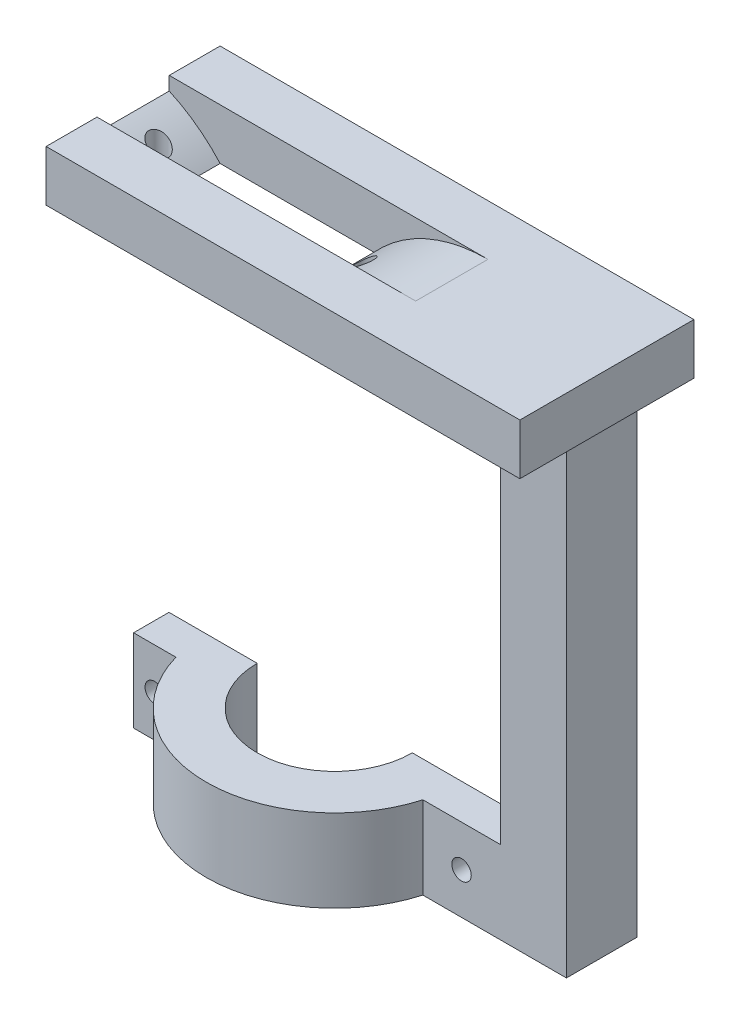
from build123d import *

# Parameters (mm, degrees)
SKETCH_1_W                = 50.28
SKETCH_1_H                = 34.2
SKETCH_1_W_2              = 30.28
SKETCH_1_H_2              = 14.2
EXTRUDE_1_DEPTH           = 12.25
SKETCH_4_W                = 13
SKETCH_4_H                = 13.91
EXTRUDE_1_2_DEPTH         = 74.82
SKETCH_5_W                = 13.91
SKETCH_5_H                = 16.23
EXTRUDE_2_DEPTH           = 16
SKETCH_7_R                = 25.25
SKETCH_7_R_2              = 15.25
EXTRUDE_2_2_DEPTH         = 16.23
SKETCH_15_R               = 1.91
CUT_EXTRUDE_6_DEPTH       = 97.964478439
SKETCH_18_W               = 49.344544624
SKETCH_18_H               = 6.125
CUT_EXTRUDE_8_DEPTH       = 101.789238284
SKETCH_19_W               = 34.2
SKETCH_19_H               = 6.125
CUT_EXTRUDE_9_DEPTH       = 10
SKETCH_21_R               = 1.91
CUT_EXTRUDE_10_DEPTH      = 10
SKETCH_20_R               = 1.91
CUT_EXTRUDE_11_DEPTH      = 10
FILLET_START              = -7.1
FILLET_1_DEPTH            = 14.2
FILLET_2_DEPTH            = 14.2
SKETCH_29_W               = 13.91
SKETCH_29_H               = 74.82
EXTRUDE_5_DEPTH           = 10
SKETCH_30_W               = 10
SKETCH_30_H               = 58.59
CUT_EXTRUDE_13_DEPTH      = 97.964478439
SKETCH_32_W               = 34.2
SKETCH_32_H               = 5.745736365
EXTRUDE_6_DEPTH           = 10
CUT_EXTRUDE_16_DEPTH      = 50
CUT_EXTRUDE_16_DEPTH_BACK = 50
SKETCH_38_W               = 116.985630298
SKETCH_38_H               = 80.538350638
SKETCH_41_W               = 13.91
SKETCH_41_H               = 5.745736365
EXTRUDE_7_DEPTH           = 3
SKETCH_42_W               = 13
SKETCH_42_H               = 13.91
EXTRUDE_8_DEPTH           = 74.82
SKETCH_43_W               = 13.91
SKETCH_43_H               = 16.23
EXTRUDE_9_DEPTH           = 15.22
SKETCH_44_R               = 1.91
CUT_EXTRUDE_17_DEPTH      = 15.22
SKETCH_46_R               = 25.25
SKETCH_46_R_2             = 15.25
EXTRUDE_6_2_DEPTH         = 16.23
EXTRUDE_10_DEPTH          = 7.22
EXTRUDE_10_DEPTH_BACK     = 10
SKETCH_47_W               = 13.91
SKETCH_47_H               = 16.23
SKETCH_50_W               = 3.056753925
SKETCH_50_H               = 16.23
CUT_EXTRUDE_18_DEPTH      = 96.578211037
SKETCH_51_R               = 1.91
CUT_EXTRUDE_19_DEPTH      = 95.015226304
SKETCH_52_W               = 92.841945613
SKETCH_52_H               = 30
CUT_EXTRUDE_20_DEPTH      = 84.840694713
CUT_EXTRUDE_22_DEPTH      = 50
CUT_EXTRUDE_22_DEPTH_BACK = 50
SKETCH_53_W               = 63.541345486
SKETCH_53_H               = 14.170740414
SKETCH_54_W               = 10
SKETCH_54_H               = 10.145
CUT_EXTRUDE_23_DEPTH      = 50
SKETCH_55_W               = 13
SKETCH_55_H               = 13.91
EXTRUDE_11_DEPTH          = 10
SKETCH_57_W               = 15
SKETCH_57_H               = 34.2
EXTRUDE_12_DEPTH          = 10
SKETCH_58_W               = 34.2
SKETCH_58_H               = 10
EXTRUDE_13_DEPTH          = 27.85
SKETCH_60_W               = 34.2
SKETCH_60_H               = 10
EXTRUDE_14_DEPTH          = 50.28
SKETCH_62_W               = 30.28
SKETCH_62_H               = 14.2
CUT_EXTRUDE_24_DEPTH      = 50.28
SKETCH_64_R               = 1.91
CUT_EXTRUDE_25_DEPTH      = 10
FILLET_3_R                = 30


with BuildPart() as part:
    # 草圖1 → Extrude 1 (new body)
    with BuildSketch(Plane(origin=(0, 0, 0), x_dir=(1, 0, 0), z_dir=(0, 1, 0))):
        Rectangle(SKETCH_1_W, SKETCH_1_H)
        Rectangle(SKETCH_1_W_2, SKETCH_1_H_2, mode=Mode.SUBTRACT)
    extrude(amount=EXTRUDE_1_DEPTH)

    # 草圖4 → Extrude 1 2 (add)
    with BuildSketch(Plane.XZ):
        with Locations((18.64, 0)):
            Rectangle(SKETCH_4_W, SKETCH_4_H)
    extrude(amount=EXTRUDE_1_2_DEPTH)

    # 草圖5 → Extrude 2 (add)
    with BuildSketch(Plane.ZY.offset(-12.14)):
        with Locations((0, -66.705)):
            Rectangle(SKETCH_5_W, SKETCH_5_H)
    extrude(amount=EXTRUDE_2_DEPTH)

    # 草圖7 → Extrude 2 2 (add)
    with BuildSketch(Plane(origin=(3.626674765, -74.82, 0), x_dir=(1, 0, 0), z_dir=(0, -1, 0))):
        with Locations((-30.978154344, 0)):
            Circle(SKETCH_7_R)
        with Locations((-30.978154344, 0)):
            Circle(SKETCH_7_R_2, mode=Mode.SUBTRACT)
    extrude(amount=-EXTRUDE_2_2_DEPTH)

    # 草圖15 → 除料-伸長6 (cut, through all)
    with BuildSketch(Plane(origin=(0, 0, -6.955), x_dir=(-1, 0, 0), z_dir=(0, 0, -1))):
        with Locations((-4.530883248, -66.705)):
            Circle(SKETCH_15_R)
    extrude(amount=-CUT_EXTRUDE_6_DEPTH, mode=Mode.SUBTRACT)

    # 草圖18 → 除料-伸長8 (cut, through all)
    with BuildSketch(Plane(origin=(0, 0, -17.1), x_dir=(-1, 0, 0), z_dir=(0, 0, -1))):
        with Locations((0.467727688, 9.1875)):
            Rectangle(SKETCH_18_W, SKETCH_18_H)
    extrude(amount=-CUT_EXTRUDE_8_DEPTH, mode=Mode.SUBTRACT)

    # 草圖19 → 除料-伸長9 (cut)
    with BuildSketch(Plane.ZY.offset(-24.204544624)):
        with Locations((0, 9.1875)):
            Rectangle(SKETCH_19_W, SKETCH_19_H)
    extrude(amount=-CUT_EXTRUDE_9_DEPTH, mode=Mode.SUBTRACT)

    # 草圖21 → 除料-伸長10 (cut)
    with BuildSketch(Plane(origin=(0, 6.125, 0), x_dir=(1, 0, 0), z_dir=(0, 1, 0))):
        with Locations(Location((17.69, 0, 0), (0, 0, 270))):
            Circle(SKETCH_21_R)
    extrude(amount=-CUT_EXTRUDE_10_DEPTH, mode=Mode.SUBTRACT)

    # 草圖20 → 除料-伸長11 (cut)
    with BuildSketch(Plane(origin=(0, 6.125, 0), x_dir=(1, 0, 0), z_dir=(0, 1, 0))):
        with Locations(Location((-17.395, 0, 0), (0, 0, 270))):
            Circle(SKETCH_20_R)
    extrude(amount=-CUT_EXTRUDE_11_DEPTH, mode=Mode.SUBTRACT)

    # 圓角1: read off the stored shape, not the designer's step
    # 圓角1 outline → 圓角1 (cut)
    with BuildSketch(Plane.XY.offset(FILLET_START)):
        with BuildLine():
            add(Edge.make_bspline(
                [(-15.14, 0), (-21.974170252, 5.199829476), (-25.14, 5.745736365)],
                knots=[0, 0, 0, 0.664102345, 0.664102345, 0.664102345], degree=2, weights=[1, 2.223777218, 1.822127795]))
            Line((-15.14, 0), (-15.14, 6.125))
            Line((-15.14, 6.125), (-25.14, 6.125))
            Line((-25.14, 6.125), (-25.14, 5.745736365))
        make_face()
    extrude(amount=FILLET_1_DEPTH, mode=Mode.SUBTRACT)

    # 圓角2: read off the stored shape, not the designer's step
    # 圓角2 outline → 圓角2 (cut)
    with BuildSketch(Plane.XY.offset(FILLET_START)):
        with BuildLine():
            Line((15.14, 6.125), (15.14, 0))
            add(Edge.make_bspline(
                [(15.14, 0), (21.974170252, 5.199829476), (25.14, 5.745736365)],
                knots=[0, 0, 0, 0.664102345, 0.664102345, 0.664102345], degree=2, weights=[1, 2.223777218, 1.822127795]))
            Line((25.14, 5.745736365), (25.14, 6.125))
            Line((25.14, 6.125), (15.14, 6.125))
        make_face()
    extrude(amount=FILLET_2_DEPTH, mode=Mode.SUBTRACT)

    # 草圖29 → 填料-伸長5 (add)
    with BuildSketch(Plane(origin=(25.14, 0, 0), x_dir=(0, 0, -1), z_dir=(1, 0, 0))):
        with Locations((0, -37.41)):
            Rectangle(SKETCH_29_W, SKETCH_29_H)
    extrude(amount=EXTRUDE_5_DEPTH)

    # 草圖30 → 除料-伸長13 (cut, through all)
    with BuildSketch(Plane.XY.offset(6.955)):
        with Locations((17.14, -29.295)):
            Rectangle(SKETCH_30_W, SKETCH_30_H)
    extrude(amount=-CUT_EXTRUDE_13_DEPTH, mode=Mode.SUBTRACT)

    # 草圖32 → Extrude 6 (add)
    with BuildSketch(Plane(origin=(25.14, 0, 0), x_dir=(0, 0, -1), z_dir=(1, 0, 0))):
        with Locations((0, 2.872868182)):
            Rectangle(SKETCH_32_W, SKETCH_32_H)
    extrude(amount=EXTRUDE_6_DEPTH)

    # 草圖38 → 除料-伸長16 (cut, two sides: drawn at the far end of the back side and taken through both)
    with BuildSketch(Plane(origin=(0, 0, -6.955), x_dir=(-1, 0, 0), z_dir=(0, 0, -1)).offset(-CUT_EXTRUDE_16_DEPTH_BACK)):
        with Locations((7.268869252, -40.269175319)):
            Rectangle(SKETCH_38_W, SKETCH_38_H)
    extrude(amount=CUT_EXTRUDE_16_DEPTH + CUT_EXTRUDE_16_DEPTH_BACK, mode=Mode.SUBTRACT)

    # 草圖41 → 填料-伸長7 (add)
    with BuildSketch(Plane(origin=(35.14, 0, 0), x_dir=(0, 0, -1), z_dir=(1, 0, 0))):
        with Locations((0, 2.872868182)):
            Rectangle(SKETCH_41_W, SKETCH_41_H)
    extrude(amount=EXTRUDE_7_DEPTH)

    # 草圖42 → 填料-伸長8 (add)
    with BuildSketch(Plane(origin=(0, 0, 0), x_dir=(-1, 0, 0), z_dir=(0, -1, 0))):
        with Locations((-31.64, 0)):
            Rectangle(SKETCH_42_W, SKETCH_42_H)
    extrude(amount=EXTRUDE_8_DEPTH)

    # 草圖43 → 填料-伸長9 (add)
    with BuildSketch(Plane.ZY.offset(-25.14)):
        with Locations((0, -66.705)):
            Rectangle(SKETCH_43_W, SKETCH_43_H)
    extrude(amount=EXTRUDE_9_DEPTH)

    # 草圖44 → 除料-伸長17 (cut)
    with BuildSketch(Plane(origin=(0, 0, -6.955), x_dir=(-1, 0, 0), z_dir=(0, 0, -1))):
        with Locations(Location((-17.524895264, -66.705, 0), (0, 0, 90))):
            Circle(SKETCH_44_R)
    extrude(amount=-CUT_EXTRUDE_17_DEPTH, mode=Mode.SUBTRACT)

    # 草圖46 → Extrude 6 2 (add)
    with BuildSketch(Plane(origin=(0, -58.59, 0), x_dir=(1, 0, 0), z_dir=(0, 1, 0))):
        with Locations((-14.35, 0)):
            Circle(SKETCH_46_R)
        with Locations((-14.35, 0)):
            Circle(SKETCH_46_R_2, mode=Mode.SUBTRACT)
    extrude(amount=-EXTRUDE_6_2_DEPTH)

    # 草圖47 → 填料-伸長10 (add, two sides: drawn at the far end of the back side and taken through both)
    with BuildSketch(Plane(origin=(-40, 0, 0), x_dir=(0, 0, -1), z_dir=(1, 0, 0)).offset(-EXTRUDE_10_DEPTH_BACK)):
        with Locations((0, -66.705)):
            Rectangle(SKETCH_47_W, SKETCH_47_H)
    extrude(amount=EXTRUDE_10_DEPTH + EXTRUDE_10_DEPTH_BACK)

    # 草圖50 → 除料-伸長18 (cut, through all)
    with BuildSketch(Plane(origin=(0, 0, -6.955), x_dir=(-1, 0, 0), z_dir=(0, 0, -1))):
        with Locations((48.471623038, -66.705)):
            Rectangle(SKETCH_50_W, SKETCH_50_H)
    extrude(amount=-CUT_EXTRUDE_18_DEPTH, mode=Mode.SUBTRACT)

    # 草圖51 → 除料-伸長19 (cut, through all)
    with BuildSketch(Plane(origin=(0, 0, -6.955), x_dir=(-1, 0, 0), z_dir=(0, 0, -1))):
        with Locations((42.786508152, -66.705)):
            Circle(SKETCH_51_R)
    extrude(amount=-CUT_EXTRUDE_19_DEPTH, mode=Mode.SUBTRACT)

    # 草圖52 → 除料-伸長20 (cut, through all)
    with BuildSketch(Plane(origin=(0, -58.59, 0), x_dir=(1, 0, 0), z_dir=(0, 1, 0))):
        with Locations((-21.280972807, 15)):
            Rectangle(SKETCH_52_W, SKETCH_52_H)
    extrude(amount=-CUT_EXTRUDE_20_DEPTH, mode=Mode.SUBTRACT)

    # 草圖53 → 除料-伸長22 (cut, two sides: drawn at the far end of the back side and taken through both)
    with BuildSketch(Plane(origin=(0, 0, -6.955), x_dir=(-1, 0, 0), z_dir=(0, 0, -1)).offset(-CUT_EXTRUDE_22_DEPTH_BACK)):
        with Locations((6.630672743, -0.960370207)):
            Rectangle(SKETCH_53_W, SKETCH_53_H)
    extrude(amount=CUT_EXTRUDE_22_DEPTH + CUT_EXTRUDE_22_DEPTH_BACK, mode=Mode.SUBTRACT)

    # 草圖54 → 除料-伸長23 (cut)
    with BuildSketch(Plane(origin=(0, 5.745736365, 0), x_dir=(1, 0, 0), z_dir=(0, 1, 0))):
        with Locations((30.14, -12.0275)):
            Rectangle(SKETCH_54_W, SKETCH_54_H)
        with Locations((30.14, 12.0275)):
            Rectangle(SKETCH_54_W, SKETCH_54_H)
    extrude(amount=-CUT_EXTRUDE_23_DEPTH, mode=Mode.SUBTRACT)

    # 草圖55 → 填料-伸長11 (add)
    with BuildSketch(Plane(origin=(0, 5.745736365, 0), x_dir=(1, 0, 0), z_dir=(0, 1, 0))):
        with Locations((31.64, 0)):
            Rectangle(SKETCH_55_W, SKETCH_55_H)
    extrude(amount=EXTRUDE_11_DEPTH)

    # 草圖57 → 填料-伸長12 (add)
    with BuildSketch(Plane(origin=(0, 15.745736365, 0), x_dir=(1, 0, 0), z_dir=(0, 1, 0))):
        with Locations((31.64, 0)):
            Rectangle(SKETCH_57_W, SKETCH_57_H)
    extrude(amount=EXTRUDE_12_DEPTH)

    # 草圖58 → 填料-伸長13 (add)
    with BuildSketch(Plane.ZY.offset(-24.14)):
        with Locations((0, 20.745736365)):
            Rectangle(SKETCH_58_W, SKETCH_58_H)
    extrude(amount=EXTRUDE_13_DEPTH)

    # 草圖60 → 填料-伸長14 (add)
    with BuildSketch(Plane.ZY.offset(3.71)):
        with Locations((0, 20.745736365)):
            Rectangle(SKETCH_60_W, SKETCH_60_H)
    extrude(amount=EXTRUDE_14_DEPTH)

    # 草圖62 → 除料-伸長24 (cut)
    with BuildSketch(Plane(origin=(0, 25.745736365, 0), x_dir=(1, 0, 0), z_dir=(0, 1, 0))):
        with Locations((-28.85, 0)):
            Rectangle(SKETCH_62_W, SKETCH_62_H)
    extrude(amount=-CUT_EXTRUDE_24_DEPTH, mode=Mode.SUBTRACT)

    # 草圖64 → 除料-伸長25 (cut)
    with BuildSketch(Plane(origin=(0, 25.745736365, 0), x_dir=(1, 0, 0), z_dir=(0, 1, 0))):
        with Locations(Location((-8.71, 0, 0), (0, 0, 270))):
            Circle(SKETCH_64_R)
        with Locations(Location((-48.99, 0, 0), (0, 0, 270))):
            Circle(SKETCH_64_R)
    extrude(amount=-CUT_EXTRUDE_25_DEPTH, mode=Mode.SUBTRACT)

    # 圓角3
    # the kernel refuses this fillet: 30 mm, written as the material it takes off along each edge
    with BuildSketch(Plane(origin=(-43.99, 25.745736365, 7.1), x_dir=(-1, 0, 0), z_dir=(0, 0, -1)), Plane(origin=(-13.71, 25.745736365, -7.1), x_dir=(1, 0, 0), z_dir=(0, 0, 1))) as fillet_3_piece_1:
        with BuildLine():
            CenterArc((22.360679775, -30), FILLET_3_R, 90, 48.189685104)
            Line((0, -10), (0, 0))
            Line((0, 0), (22.360679775, 0))
        make_face()
    extrude(amount=14.2, mode=Mode.SUBTRACT)


solid = part.part
